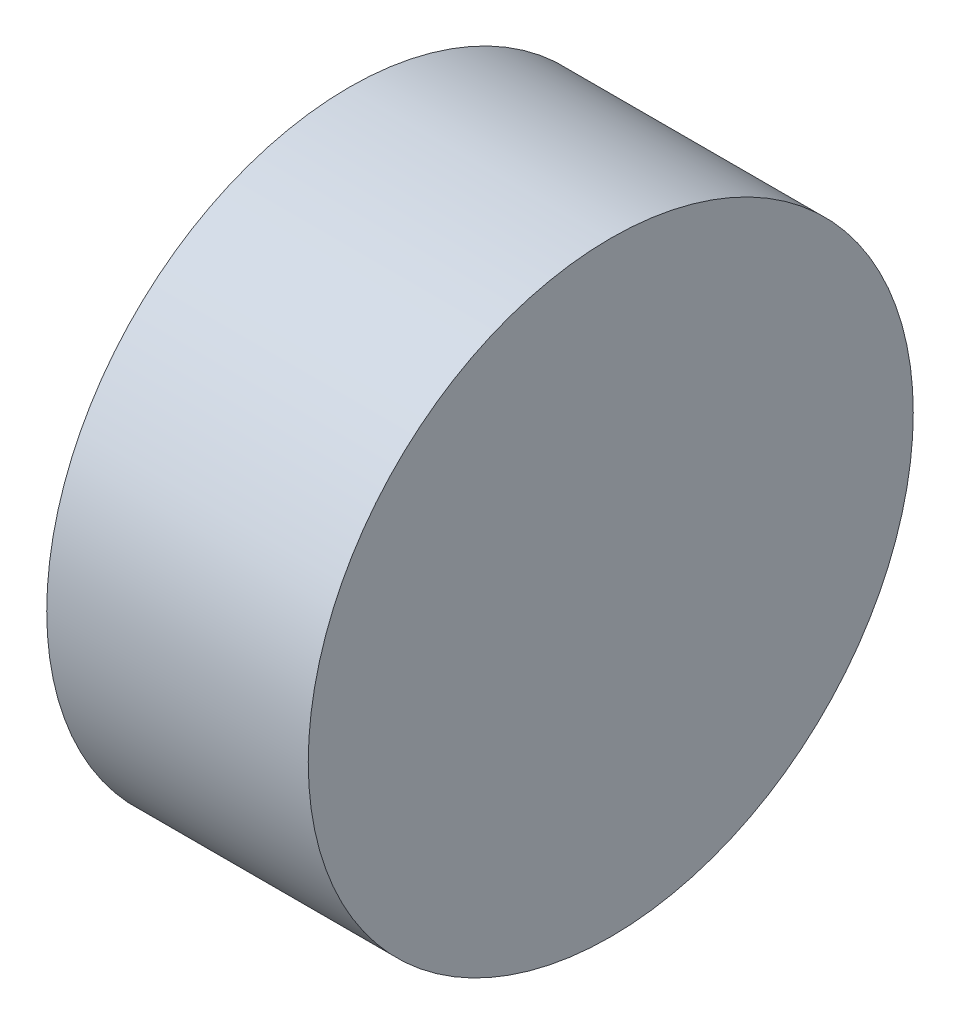
from build123d import *

# Parameters (mm, degrees)
SKETCH1_R           = 11.568181062
BOSS_EXTRUDE1_DEPTH = 10


with BuildPart() as part:
    # Sketch1 → Boss-Extrude1 (new body)
    with BuildSketch(Plane(origin=(0, 0, 0), x_dir=(0, 0, -1), z_dir=(1, 0, 0))):
        Circle(SKETCH1_R)
    extrude(amount=BOSS_EXTRUDE1_DEPTH)


solid = part.part
